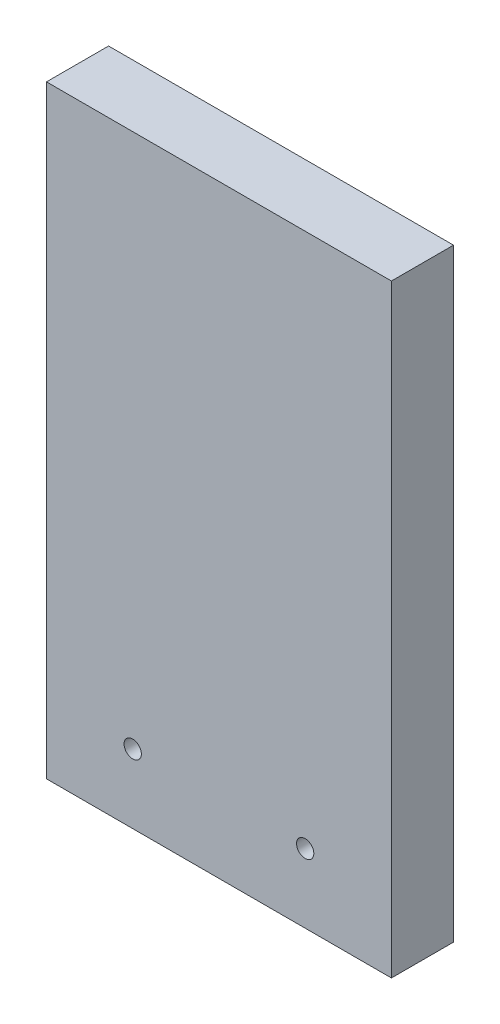
from build123d import *

# Parameters (mm, degrees)
ESBO_O1_W                = 10
ESBO_O1_H                = 17.5
RESSALTO_EXTRUS_O1_DEPTH = 1.8
ESBO_O2_R                = 0.25
CORTE_EXTRUS_O1_DEPTH    = 122.014075025


with BuildPart() as part:
    # Esboço1 → Ressalto-extrusão1 (new body)
    with BuildSketch(Plane.XY):
        with Locations((90.843569867, 65.109166454)):
            Rectangle(ESBO_O1_W, ESBO_O1_H)
    extrude(amount=RESSALTO_EXTRUS_O1_DEPTH)

    # Esboço2 → Corte-extrusão1 (cut, through all)
    with BuildSketch(Plane.XY.offset(1.8)):
        with Locations((88.343569867, 58.359166454)):
            Circle(ESBO_O2_R)
        with Locations((93.343569867, 58.359166454)):
            Circle(ESBO_O2_R)
    extrude(amount=-CORTE_EXTRUS_O1_DEPTH, mode=Mode.SUBTRACT)


solid = part.part
